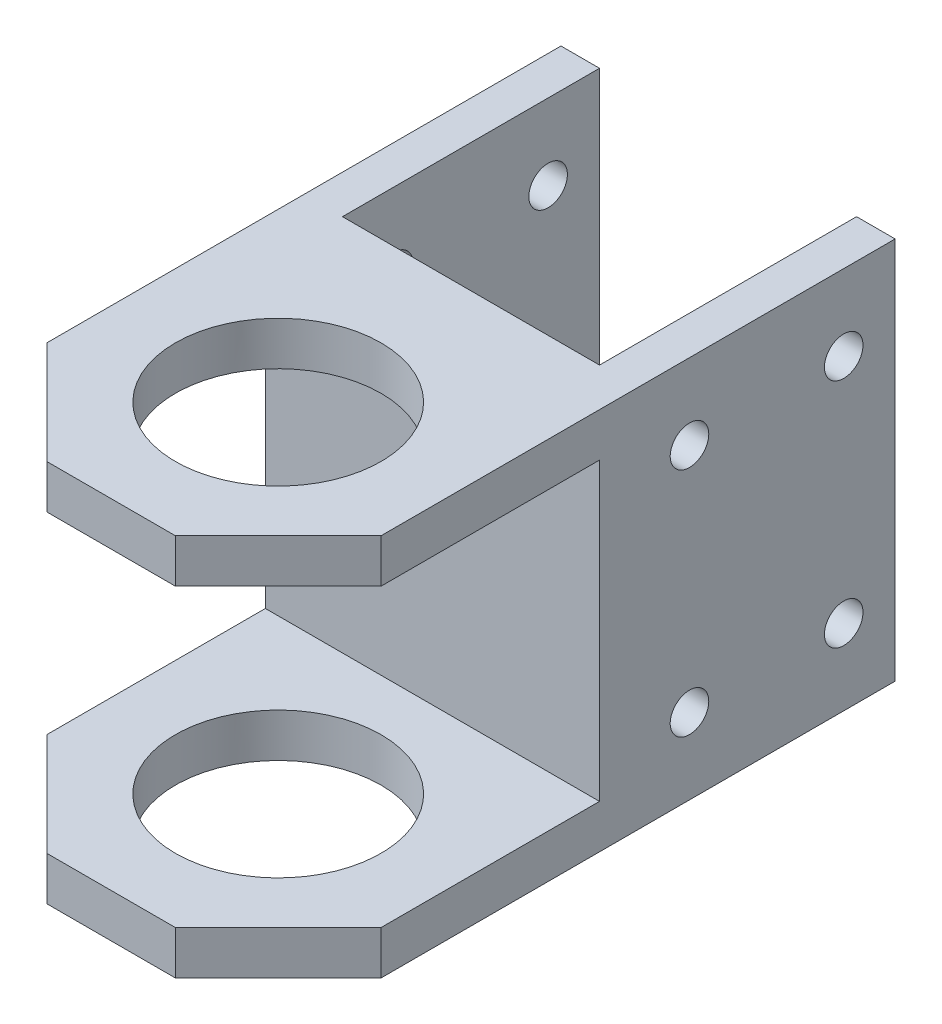
from build123d import *

# Parameters (mm, degrees)
SKETCH_1_W           = 26
SKETCH_1_H           = 20
EXTRUDE_1_DEPTH      = 3
EXTRUDE_2_DEPTH      = 16
SKETCH_5_W           = 3
SKETCH_5_H           = 20
EXTRUDE_3_DEPTH      = 20
SKETCH_8_W           = 23
SKETCH_8_H           = 8
CUT_EXTRUDE_5_DEPTH  = 40
CHAMFER_1_SIZE       = 8
SKETCH_16_W          = 23
SKETCH_16_H          = 4
CUT_EXTRUDE_8_DEPTH  = 26
SKETCH_17_W          = 16.892856711
SKETCH_17_H          = 8
CUT_EXTRUDE_9_DEPTH  = 10
EXTRUDE_4_DEPTH      = 14
CUT_EXTRUDE_10_DEPTH = 14
SKETCH_20_R          = 8
CUT_EXTRUDE_11_DEPTH = 39
SKETCH_21_R          = 9
CUT_EXTRUDE_12_DEPTH = 0.1
CUT_EXTRUDE_START    = -0.1
SKETCH_22_R          = 9
CUT_EXTRUDE_13_DEPTH = 0.1
SKETCH_23_R          = 1.5
CUT_EXTRUDE_14_DEPTH = 38.1
CUT_EXTRUDE_15_DEPTH = 0.5
CUT_EXTRUDE_16_DEPTH = 0.5
CUT_EXTRUDE_17_DEPTH = 0.1
CUT_EXTRUDE_18_DEPTH = 0.1


with BuildPart() as part:
    # 草图1 → 凸台-拉伸1 (new body)
    with BuildSketch(Plane.XY):
        Rectangle(SKETCH_1_W, SKETCH_1_H)
    extrude(amount=EXTRUDE_1_DEPTH)

    # 草图2 → 凸台-拉伸2 (add)
    with BuildSketch(Plane.XZ.offset(10)):
        Polygon((-13, 3), (-13, 15), (-13, 28), (13, 28), (13, 15), (13, 3), align=None)
    extrude(amount=-EXTRUDE_2_DEPTH)

    # 草图5 → 凸台-拉伸3 (add)
    with BuildSketch(Plane(origin=(0, 0, 0), x_dir=(-1, 0, 0), z_dir=(0, 0, -1))):
        with Locations((11.5, 0)):
            Rectangle(SKETCH_5_W, SKETCH_5_H)
        with Locations((-11.5, 0)):
            Rectangle(SKETCH_5_W, SKETCH_5_H)
    extrude(amount=EXTRUDE_3_DEPTH)

    # 草图8 → 切除-拉伸5 (cut)
    with BuildSketch(Plane(origin=(13, 0, 0), x_dir=(0, 0, -1), z_dir=(1, 0, 0))):
        with Locations((-14.5, -2)):
            Rectangle(SKETCH_8_W, SKETCH_8_H)
    extrude(amount=-CUT_EXTRUDE_5_DEPTH, mode=Mode.SUBTRACT)

    # 倒角1
    # the kernel refuses this chamfer: 8 mm, written as the material it takes off along each edge
    with BuildSketch(Plane(origin=(-13, -30.573463904, 28), x_dir=(-0.02749587661058627, 0, -0.9996219169112968), z_dir=(0, 1, 0)), Plane(origin=(13, -30.573463904, 28), x_dir=(-0.9996219169112968, 0, 0.027495876610586487), z_dir=(0, 1, 0))) as chamfer_1_piece_1:
        Polygon((CHAMFER_1_SIZE * 0.999621916911, -CHAMFER_1_SIZE * 0.0274958766106), (-CHAMFER_1_SIZE * 0.0274958766106, -CHAMFER_1_SIZE * 0.999621916911), (0, 0), align=None)
    extrude(amount=57.146927807, mode=Mode.SUBTRACT)

    # 草图16 → 切除-拉伸8 (cut)
    with BuildSketch(Plane(origin=(13, 0, 0), x_dir=(0, 0, -1), z_dir=(1, 0, 0))):
        with Locations((8.5, 8)):
            Rectangle(SKETCH_16_W, SKETCH_16_H)
    extrude(amount=-CUT_EXTRUDE_8_DEPTH, mode=Mode.SUBTRACT)

    # 草图17 → 切除-拉伸9 (cut)
    with BuildSketch(Plane.XY.offset(28)):
        with Locations((0.093159136, -2)):
            Rectangle(SKETCH_17_W, SKETCH_17_H)
    extrude(amount=-CUT_EXTRUDE_9_DEPTH, mode=Mode.SUBTRACT)

    # 草图18 → 凸台-拉伸4 (add)
    with BuildSketch(Plane.XZ.offset(10)):
        Polygon((5, 28), (-5, 28), (-13, 20), (-13, -20), (-10, -20), (-10, 0), (10, 0), (10, -20), (13, -20), (13, 20), align=None)
    extrude(amount=EXTRUDE_4_DEPTH)

    # 草图19 → 切除-拉伸10 (cut)
    with BuildSketch(Plane(origin=(0, -6, 0), x_dir=(1, 0, 0), z_dir=(0, 1, 0))):
        Polygon((5, -28), (13, -20), (13, -3), (-13, -3), (-13, -20), (-5, -28), align=None)
    extrude(amount=-CUT_EXTRUDE_10_DEPTH, mode=Mode.SUBTRACT)

    # 草图20 → 切除-拉伸11 (cut)
    with BuildSketch(Plane.XZ.offset(24)):
        with Locations(Location((0, 15, 0), (0, 0, 270))):
            Circle(SKETCH_20_R)
    extrude(amount=-CUT_EXTRUDE_11_DEPTH, mode=Mode.SUBTRACT)

    # 草图21 → 切除-拉伸12 (cut)
    with BuildSketch(Plane.XZ.offset(24)):
        with Locations(Location((0, 15, 0), (0, 0, 270))):
            Circle(SKETCH_21_R)
    extrude(amount=-CUT_EXTRUDE_12_DEPTH, mode=Mode.SUBTRACT)

    # 草图22 → 切除-拉伸13 (cut)
    with BuildSketch(Plane(origin=(0, 6, 0), x_dir=(1, 0, 0), z_dir=(0, 1, 0)).offset(CUT_EXTRUDE_START)):
        with Locations(Location((0, -15, 0), (0, 0, 90))):
            Circle(SKETCH_22_R)
    extrude(amount=CUT_EXTRUDE_13_DEPTH, mode=Mode.SUBTRACT)

    # 草图23 → 切除-拉伸14 (cut)
    with BuildSketch(Plane(origin=(13, 0, 0), x_dir=(0, 0, -1), z_dir=(1, 0, 0))):
        with Locations((4, 0)):
            Circle(SKETCH_23_R)
        with Locations((16, 0)):
            Circle(SKETCH_23_R)
        with Locations((4, -18)):
            Circle(SKETCH_23_R)
        with Locations((16, -18)):
            Circle(SKETCH_23_R)
    extrude(amount=-CUT_EXTRUDE_14_DEPTH, mode=Mode.SUBTRACT)

    # 草图24 → 切除-拉伸15 (cut)
    with BuildSketch(Plane.XZ.offset(-2)):
        Polygon((-5, 28), (-13, 20), (-13, 3), (13, 3), (13, 20), (5, 28), align=None)
    extrude(amount=-CUT_EXTRUDE_15_DEPTH, mode=Mode.SUBTRACT)

    # 草图25 → 切除-拉伸16 (cut)
    with BuildSketch(Plane(origin=(0, -20, 0), x_dir=(1, 0, 0), z_dir=(0, 1, 0))):
        Polygon((-5, -28), (5, -28), (13, -20), (13, -3), (-13, -3), (-13, -20), align=None)
    extrude(amount=-CUT_EXTRUDE_16_DEPTH, mode=Mode.SUBTRACT)

    # 草图26 → 切除-拉伸17 (cut)
    with BuildSketch(Plane.XZ.offset(24)):
        Polygon((13, 20), (5, 28), (-5, 28), (-13, 20), (-13, -20), (-10, -20), (-10, 0), (10, 0), (10, -20), (13, -20), align=None)
    extrude(amount=-CUT_EXTRUDE_17_DEPTH, mode=Mode.SUBTRACT)

    # 草图27 → 切除-拉伸18 (cut)
    with BuildSketch(Plane(origin=(0, 6, 0), x_dir=(1, 0, 0), z_dir=(0, 1, 0))):
        Polygon((-13, 20), (-13, -20), (-5, -28), (5, -28), (13, -20), (13, 20), (10, 20), (10, 0), (-10, 0), (-10, 20), align=None)
    extrude(amount=-CUT_EXTRUDE_18_DEPTH, mode=Mode.SUBTRACT)


solid = part.part
